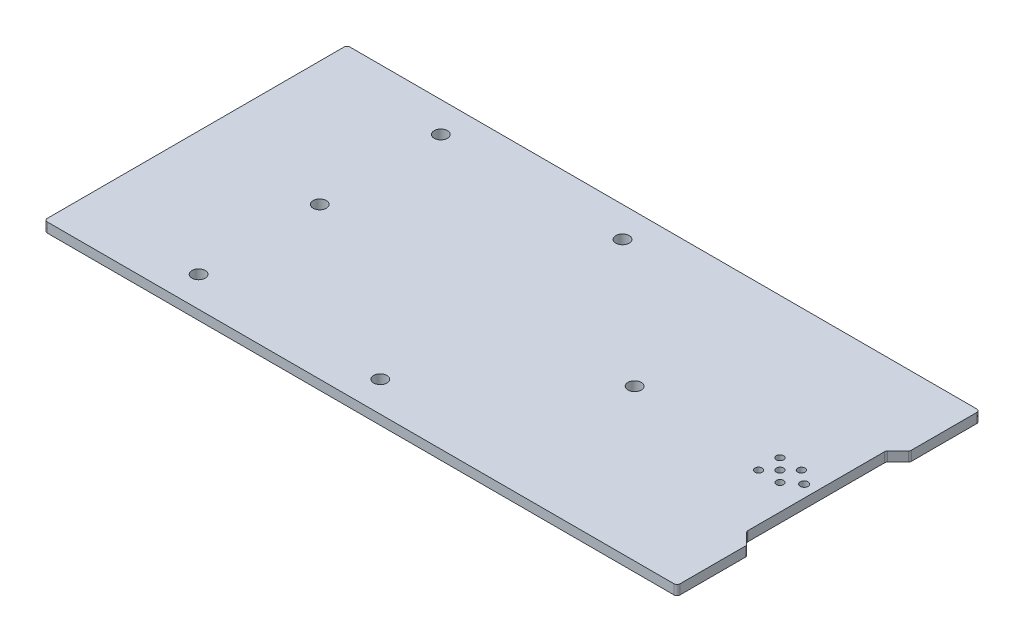
from build123d import *

# Parameters (mm, degrees)
BOSS_EXTRUDE1_DEPTH      = 1.6
SKETCH2_R                = 1.1
CUT_EXTRUDE1_DEPTH       = 116.85685133
M12_MOUNTING_HOLES_REACH = 117.857
SKETCH3_R                = 0.6
SKETCH3_R_2              = 0.65


with BuildPart() as part:
    # Sketch1 → Boss-Extrude1 (new body)
    with BuildSketch(Plane(origin=(0, 0, 0), x_dir=(1, 0, 0), z_dir=(0, 1, 0))):
        with BuildLine():
            Line((102.5, 50), (103.992600234, 50))
            ThreePointArc((103.992600234, 50), (104.351386049, 49.851386049), (104.5, 49.492600234))
            Line((104.5, 49.492600234), (104.5, 38.710171865))
            ThreePointArc((104.5, 38.710171865), (104.461376493, 38.515998381), (104.351386049, 38.351386049))
            Line((104.351386049, 38.351386049), (102.648613951, 36.648613951))
            ThreePointArc((102.648613951, 36.648613951), (102.538623507, 36.484001619), (102.5, 36.289828135))
            Line((102.5, 36.289828135), (102.5, 13.710171865))
            ThreePointArc((102.5, 13.710171865), (102.538623507, 13.515998381), (102.648613951, 13.351386049))
            Line((102.648613951, 13.351386049), (104.351386049, 11.648613951))
            ThreePointArc((104.351386049, 11.648613951), (104.461376493, 11.484001619), (104.5, 11.289828135))
            Line((104.5, 11.289828135), (104.5, 0.507399766))
            ThreePointArc((104.5, 0.507399766), (104.351386049, 0.148613951), (103.992600234, 0))
            Line((103.992600234, 0), (102.5, 0))
            Line((102.5, 0), (0.507399766, 0))
            ThreePointArc((0.507399766, 0), (0.148613951, 0.148613951), (0, 0.507399766))
            Line((0, 0.507399766), (0, 49.492600234))
            ThreePointArc((0, 49.492600234), (0.148613951, 49.851386049), (0.507399766, 50))
            Line((0.507399766, 50), (102.5, 50))
        make_face()
    extrude(amount=BOSS_EXTRUDE1_DEPTH)

    # Sketch2 → Cut-Extrude1 (cut, through all)
    with BuildSketch(Plane(origin=(0, 1.6, 0), x_dir=(1, 0, 0), z_dir=(0, 1, 0))):
        with Locations((20.5, 5)):
            Circle(SKETCH2_R)
        with Locations((20.5, 25)):
            Circle(SKETCH2_R)
        with Locations((20.5, 45)):
            Circle(SKETCH2_R)
        with Locations((50.5, 45)):
            Circle(SKETCH2_R)
        with Locations((50.5, 5)):
            Circle(SKETCH2_R)
        with Locations((72.5, 25)):
            Circle(SKETCH2_R)
    extrude(amount=-CUT_EXTRUDE1_DEPTH, mode=Mode.SUBTRACT)

    # Sketch3 → M12 mounting holes (cut, up to next)
    with BuildSketch(Plane(origin=(0, 1.6, 0), x_dir=(1, 0, 0), z_dir=(0, 1, 0)), mode=Mode.PRIVATE) as m12_mounting_holes_sk1:
        with Locations((96.5, 25)):
            Circle(SKETCH3_R)
    m12_mounting_holes_tool1 = extrude(m12_mounting_holes_sk1.sketch, amount=-M12_MOUNTING_HOLES_REACH, mode=Mode.PRIVATE) & part.part
    # Sketch3 → M12 mounting holes (cut, up to next)
    with BuildSketch(Plane(origin=(0, 1.6, 0), x_dir=(1, 0, 0), z_dir=(0, 1, 0)), mode=Mode.PRIVATE) as m12_mounting_holes_sk2:
        with Locations((94.732233047, 26.767766953)):
            Circle(SKETCH3_R)
    m12_mounting_holes_tool2 = extrude(m12_mounting_holes_sk2.sketch, amount=-M12_MOUNTING_HOLES_REACH, mode=Mode.PRIVATE) & part.part
    # Sketch3 → M12 mounting holes (cut, up to next)
    with BuildSketch(Plane(origin=(0, 1.6, 0), x_dir=(1, 0, 0), z_dir=(0, 1, 0)), mode=Mode.PRIVATE) as m12_mounting_holes_sk3:
        with Locations((98.267766953, 26.767766953)):
            Circle(SKETCH3_R)
    m12_mounting_holes_tool3 = extrude(m12_mounting_holes_sk3.sketch, amount=-M12_MOUNTING_HOLES_REACH, mode=Mode.PRIVATE) & part.part
    # Sketch3 → M12 mounting holes (cut, up to next)
    with BuildSketch(Plane(origin=(0, 1.6, 0), x_dir=(1, 0, 0), z_dir=(0, 1, 0)), mode=Mode.PRIVATE) as m12_mounting_holes_sk4:
        with Locations((98.267766953, 23.232233047)):
            Circle(SKETCH3_R)
    m12_mounting_holes_tool4 = extrude(m12_mounting_holes_sk4.sketch, amount=-M12_MOUNTING_HOLES_REACH, mode=Mode.PRIVATE) & part.part
    # Sketch3 → M12 mounting holes (cut, up to next)
    with BuildSketch(Plane(origin=(0, 1.6, 0), x_dir=(1, 0, 0), z_dir=(0, 1, 0)), mode=Mode.PRIVATE) as m12_mounting_holes_sk5:
        with Locations((94.732233047, 23.232233047)):
            Circle(SKETCH3_R)
    m12_mounting_holes_tool5 = extrude(m12_mounting_holes_sk5.sketch, amount=-M12_MOUNTING_HOLES_REACH, mode=Mode.PRIVATE) & part.part
    # Sketch3 → M12 mounting holes (cut, up to next)
    with BuildSketch(Plane(origin=(0, 1.6, 0), x_dir=(1, 0, 0), z_dir=(0, 1, 0)), mode=Mode.PRIVATE) as m12_mounting_holes_sk6:
        with Locations((100.5, 25)):
            Circle(SKETCH3_R_2)
    m12_mounting_holes_tool6 = extrude(m12_mounting_holes_sk6.sketch, amount=-M12_MOUNTING_HOLES_REACH, mode=Mode.PRIVATE) & part.part
    add(m12_mounting_holes_tool1.solids().sort_by_distance((96.5, 1.6, -25))[0], mode=Mode.SUBTRACT)
    add(m12_mounting_holes_tool2.solids().sort_by_distance((94.732233, 1.6, -26.767767))[0], mode=Mode.SUBTRACT)
    add(m12_mounting_holes_tool3.solids().sort_by_distance((98.267767, 1.6, -26.767767))[0], mode=Mode.SUBTRACT)
    add(m12_mounting_holes_tool4.solids().sort_by_distance((98.267767, 1.6, -23.232233))[0], mode=Mode.SUBTRACT)
    add(m12_mounting_holes_tool5.solids().sort_by_distance((94.732233, 1.6, -23.232233))[0], mode=Mode.SUBTRACT)
    add(m12_mounting_holes_tool6.solids().sort_by_distance((100.5, 1.6, -25))[0], mode=Mode.SUBTRACT)


solid = part.part
